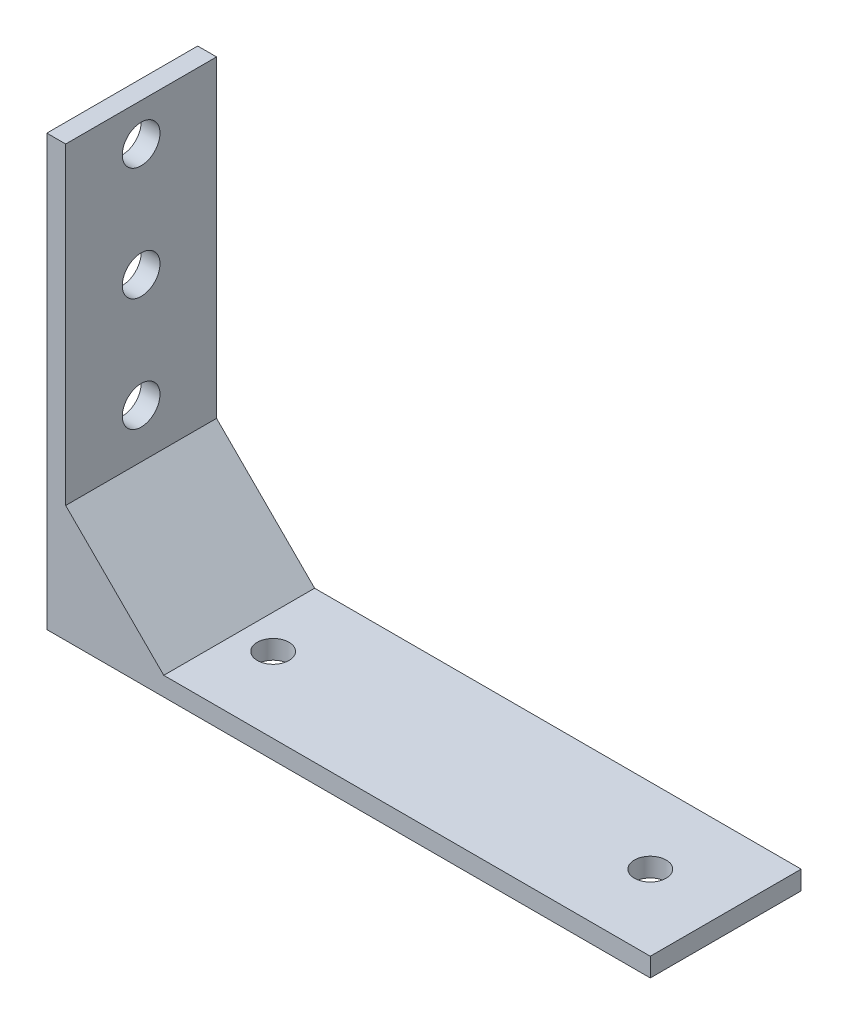
from build123d import *

# Parameters (mm, degrees)
BOSS_EXTRUDE1_DEPTH = 25.4
SKETCH2_R           = 2.667
CUT_EXTRUDE1_DEPTH  = 25.4
SKETCH3_R           = 3.175
CUT_EXTRUDE2_DEPTH  = 128.310769772
BOSS_EXTRUDE2_DEPTH = 25.4


with BuildPart() as part:
    # Sketch1 → Boss-Extrude1 (new body)
    with BuildSketch(Plane.XY):
        Polygon((0, 3.175), (0, 0), (3.175, 0), (101.6, 0), (101.6, 3.175), (3.175, 3.175), (3.175, 72.39), (0, 72.39), align=None)
    extrude(amount=BOSS_EXTRUDE1_DEPTH)

    # Sketch2 → Cut-Extrude1 (cut)
    with BuildSketch(Plane(origin=(0, 3.175, 0), x_dir=(1, 0, 0), z_dir=(0, 1, 0))):
        with Locations((88.9, -12.7)):
            Circle(SKETCH2_R)
        with Locations((25.4, -12.7)):
            Circle(SKETCH2_R)
    extrude(amount=-CUT_EXTRUDE1_DEPTH, mode=Mode.SUBTRACT)

    # Sketch3 → Cut-Extrude2 (cut, through all)
    with BuildSketch(Plane.ZY):
        with Locations((12.7, 27.94)):
            Circle(SKETCH3_R)
        with Locations((12.7, 46.99)):
            Circle(SKETCH3_R)
        with Locations((12.7, 66.04)):
            Circle(SKETCH3_R)
    extrude(amount=-CUT_EXTRUDE2_DEPTH, mode=Mode.SUBTRACT)

    # Sketch4 → Boss-Extrude2 (add)
    with BuildSketch(Plane.XY.offset(25.4)):
        Polygon((3.175, 19.685), (19.685, 3.175), (3.175, 3.175), align=None)
    extrude(amount=-BOSS_EXTRUDE2_DEPTH)


solid = part.part
